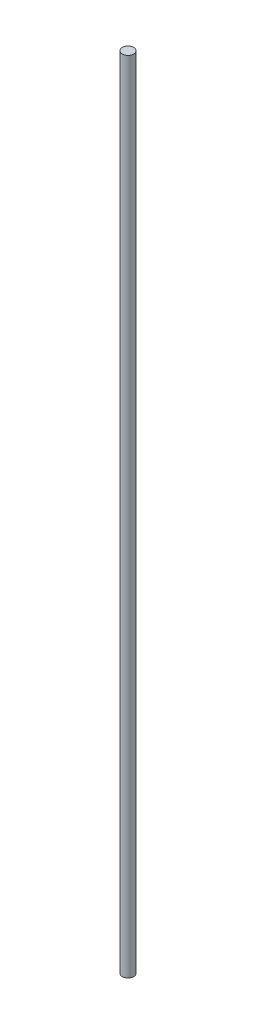
from build123d import *

# Parameters (mm, degrees)
SKETCH1_R           = 4
BOSS_EXTRUDE1_DEPTH = 555


with BuildPart() as part:
    # Sketch1 → Boss-Extrude1 (new body)
    with BuildSketch(Plane(origin=(0, 0, 0), x_dir=(1, 0, 0), z_dir=(0, 1, 0))):
        Circle(SKETCH1_R)
    extrude(amount=BOSS_EXTRUDE1_DEPTH)


solid = part.part
